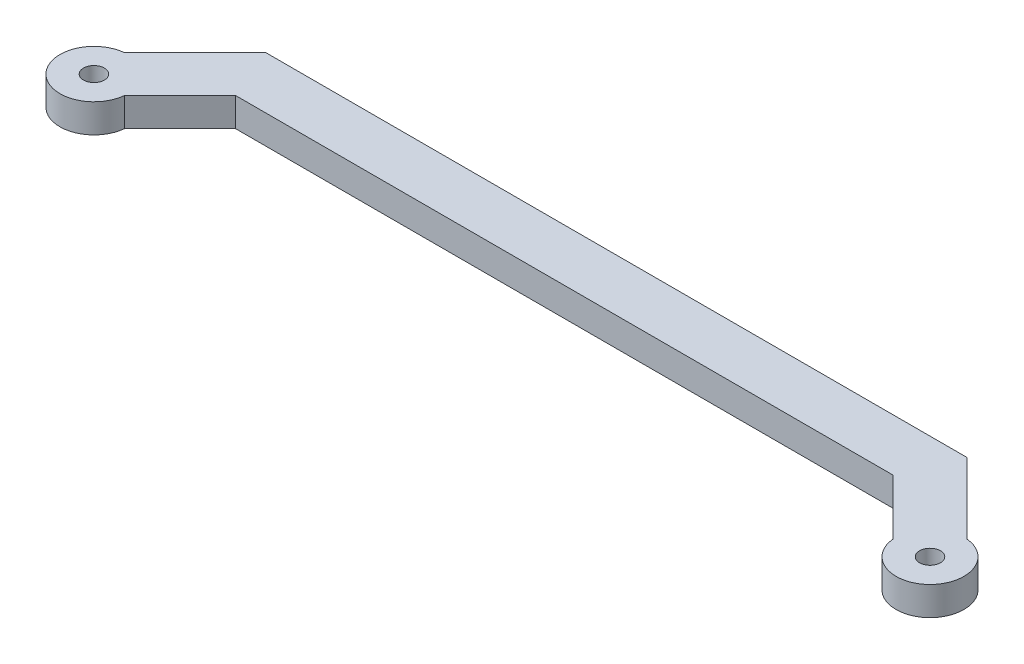
from build123d import *

# Parameters (mm, degrees)
SKETCH1_R           = 2
BOSS_EXTRUDE1_DEPTH = 5.5


with BuildPart() as part:
    # Sketch1 → Boss-Extrude1 (new body)
    with BuildSketch(Plane(origin=(0, 0, 0), x_dir=(1, 0, 0), z_dir=(0, 1, 0))):
        with BuildLine():
            Line((-62.928932188, 0), (62.928932188, 0))
            Line((62.928932188, 0), (73.527631063, -10.598698875))
            ThreePointArc((73.527631063, -10.598698875), (84.596194078, -14.596194078), (80.598698875, -3.527631063))
            Line((80.598698875, -3.527631063), (67.071067812, 10))
            Line((67.071067812, 10), (-67.071067812, 10))
            Line((-67.071067812, 10), (-80.598698875, -3.527631063))
            ThreePointArc((-80.598698875, -3.527631063), (-84.596194078, -14.596194078), (-73.527631063, -10.598698875))
            Line((-73.527631063, -10.598698875), (-62.928932188, 0))
        make_face()
        with Locations((80, -10)):
            Circle(SKETCH1_R, mode=Mode.SUBTRACT)
        with Locations((-80, -10)):
            Circle(SKETCH1_R, mode=Mode.SUBTRACT)
    extrude(amount=BOSS_EXTRUDE1_DEPTH)


solid = part.part
